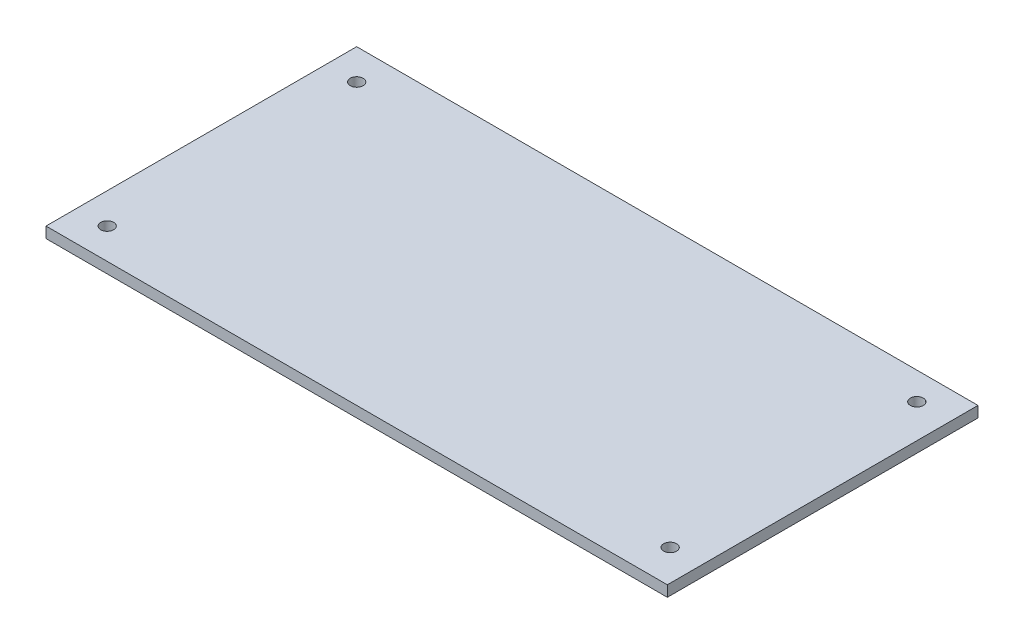
from build123d import *

# Parameters (mm, degrees)
SKETCH1_W           = 304.8
SKETCH1_H           = 152.4
BOSS_EXTRUDE1_DEPTH = 5.334
SKETCH2_R           = 3.175
CUT_EXTRUDE1_DEPTH  = 10


with BuildPart() as part:
    # Sketch1 → Boss-Extrude1 (new body)
    with BuildSketch(Plane(origin=(0, 0, 0), x_dir=(1, 0, 0), z_dir=(0, 1, 0))):
        with Locations((-63.754910023, -52.424694992)):
            Rectangle(SKETCH1_W, SKETCH1_H)
    extrude(amount=BOSS_EXTRUDE1_DEPTH)

    # Sketch2 → Cut-Extrude1 (cut)
    with BuildSketch(Plane(origin=(0, 5.334, 0), x_dir=(1, 0, 0), z_dir=(0, 1, 0))):
        with Locations((-201.154910023, -113.624694992)):
            Circle(SKETCH2_R)
        with Locations((-201.154910023, 8.775305008)):
            Circle(SKETCH2_R)
        with Locations((73.468003191, -112.082866523)):
            Circle(SKETCH2_R)
        with Locations((72.093654241, 10.309417404)):
            Circle(SKETCH2_R)
    extrude(amount=-CUT_EXTRUDE1_DEPTH, mode=Mode.SUBTRACT)


solid = part.part
